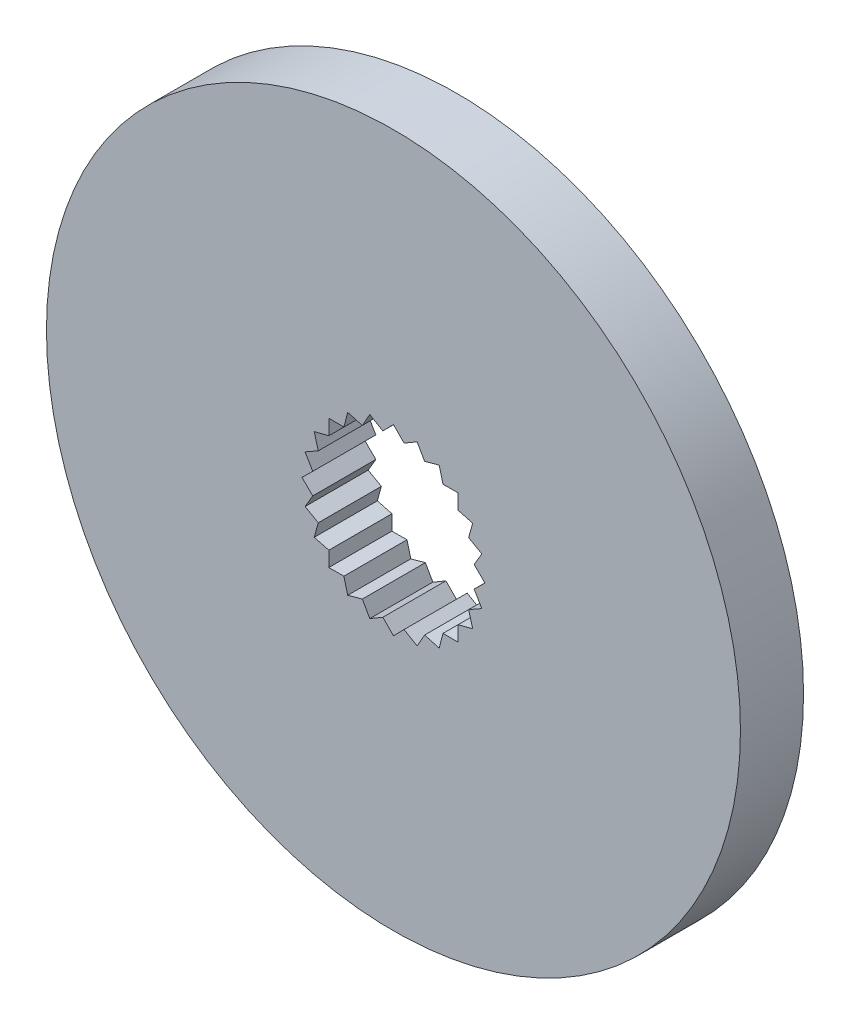
from build123d import *

# Parameters (mm, degrees)
SKETCH1_R           = 11
BOSS_EXTRUDE1_DEPTH = 2


with BuildPart() as part:
    # Sketch1 → Boss-Extrude1 (new body)
    with BuildSketch(Plane.XY):
        Circle(SKETCH1_R)
        Polygon((0.750575231, 2.801184896), (0.336757576, 2.557927742), (0, 2.9), (-0.336757576, 2.557927742), (-0.750575231, 2.801184896), (-0.987323255, 2.383609194), (-1.45, 2.511473671), (-1.570604487, 2.046851618), (-2.050609665, 2.050609665), (-2.046851618, 1.570604487), (-2.511473671, 1.45), (-2.383609194, 0.987323256), (-2.801184896, 0.750575231), (-2.557927742, 0.336757576), (-2.9, 0), (-2.557927742, -0.336757576), (-2.801184896, -0.750575231), (-2.383609194, -0.987323255), (-2.511473671, -1.45), (-2.046851618, -1.570604487), (-2.050609665, -2.050609665), (-1.570604487, -2.046851618), (-1.45, -2.511473671), (-0.987323255, -2.383609194), (-0.750575231, -2.801184896), (-0.336757576, -2.557927742), (0, -2.9), (0.336757576, -2.557927742), (0.750575231, -2.801184896), (0.987323255, -2.383609194), (1.45, -2.511473671), (1.570604487, -2.046851618), (2.050609665, -2.050609665), (2.046851618, -1.570604487), (2.511473671, -1.45), (2.383609194, -0.987323255), (2.801184896, -0.750575231), (2.557927742, -0.336757576), (2.9, 0), (2.557927742, 0.336757576), (2.801184896, 0.750575231), (2.383609194, 0.987323256), (2.511473671, 1.45), (2.046851618, 1.570604487), (2.050609665, 2.050609665), (1.570604487, 2.046851618), (1.45, 2.511473671), (0.987323255, 2.383609194), align=None, mode=Mode.SUBTRACT)
    extrude(amount=BOSS_EXTRUDE1_DEPTH)


solid = part.part
